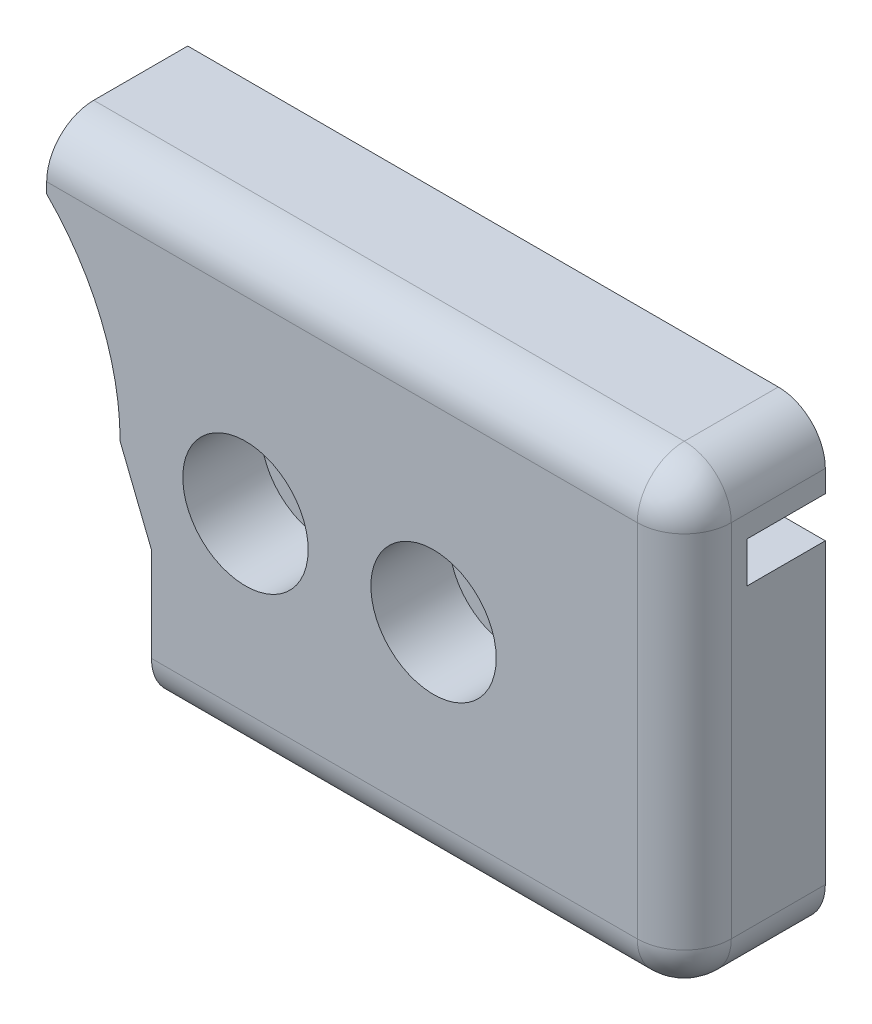
from build123d import *

# Parameters (mm, degrees)
BOSS_EXTRUDE1_DEPTH = 2
BOSS_EXTRUDE2_START = 2.5
BOSS_EXTRUDE2_DEPTH = 2.5
CUT_EXTRUDE1_DEPTH  = 2.5
BOSS_EXTRUDE3_DEPTH = 2.3
SKETCH9_R           = 2.1
CUT_EXTRUDE2_DEPTH  = 2.5
SKETCH10_R          = 2.5
BOSS_EXTRUDE4_DEPTH = 1.2
SKETCH11_R          = 0.95
CUT_EXTRUDE3_DEPTH  = 9.2
SKETCH12_R          = 2
CUT_EXTRUDE4_DEPTH  = 2.5
SKETCH14_W          = 20.343145751
SKETCH14_H          = 1.841510486
SKETCH14_W_2        = 17
SKETCH14_H_2        = 1.34163614
BOSS_EXTRUDE5_DEPTH = 1.2
FILLET1_R           = 1.5
SKETCH17_R          = 0.95
CUT_EXTRUDE5_DEPTH  = 3


# Read off the part's stored shape, not the designer's step: Boss-Extrude3
with BuildPart() as part:
    # Sketch5 → Boss-Extrude1 (new body)
    with BuildSketch(Plane.XY):
        with BuildLine():
            Line((8, 0), (9, -2.501635265))
            Line((9, -2.501635265), (9, -7.001635265))
            Line((9, -7.001635265), (26, -7.001635265))
            Line((26, -7.001635265), (26, 7.498364735))
            Line((26, 7.498364735), (5.656854249, 7.498364735))
            Line((5.656854249, 7.498364735), (5.656854249, 5.656854249))
            ThreePointArc((5.656854249, 5.656854249), (7.39103626, 3.061467459), (8, 0))
        make_face()
    extrude(amount=BOSS_EXTRUDE1_DEPTH)

    # Sketch6 → Boss-Extrude2 (add)
    with BuildSketch(Plane(origin=(0, 0, 0), x_dir=(-1, 0, 0), z_dir=(0, 0, -1)).offset(BOSS_EXTRUDE2_START)):
        with BuildLine():
            Line((-5.656854249, 7.498364735), (-5.656854249, 5.656854249))
            ThreePointArc((-5.656854249, 5.656854249), (-7.39103626, 3.061467459), (-8, 0))
            Line((-8, 0), (-9, -2.501635265))
            Line((-9, -2.501635265), (-9, -7.001635265))
            Line((-9, -7.001635265), (-26, -7.001635265))
            Line((-26, -7.001635265), (-26, 7.498364735))
            Line((-26, 7.498364735), (-5.656854249, 7.498364735))
        make_face()
    extrude(amount=-BOSS_EXTRUDE2_DEPTH)

    # Sketch7 → Cut-Extrude1 (cut)
    with BuildSketch(Plane(origin=(0, 0, -2.5), x_dir=(-1, 0, 0), z_dir=(0, 0, -1))):
        Polygon((-26, 5.298364735), (-2.738141148, 5.298364735), (-2.738141148, 3.998364735), (-29.849535112, 3.998364735), (-29.849535112, 5.298364735), align=None)
    extrude(amount=-CUT_EXTRUDE1_DEPTH, mode=Mode.SUBTRACT)

    # Boss-Extrude3 outline → Boss-Extrude3 (add)
    with BuildSketch(Plane(origin=(0, 0, -2.5), x_dir=(-1, 0, 0), z_dir=(0, 0, -1))):
        with BuildLine():
            Line((-9, -7.001635265), (-9, -5.659999125))
            Line((-9, -5.659999125), (0, -5.659998688))
            ThreePointArc((0, -5.659998688), (5.659998688, 0), (0, 5.659998688))
            Line((0, 5.659998688), (-5.656854249, 5.656854249))
            Line((-5.656854249, 5.656854249), (-5.656854249, 7.498364735))
            Line((-5.656854249, 7.498364735), (-26, 7.498364735))
            Line((-26, 7.498364735), (-26, -7.001635265))
            Line((-26, -7.001635265), (-9, -7.001635265))
        make_face()
    extrude(amount=BOSS_EXTRUDE3_DEPTH)

    # Sketch9 → Cut-Extrude2 (cut)
    with BuildSketch(Plane(origin=(0, 0, -4.8), x_dir=(-1, 0, 0), z_dir=(0, 0, -1))):
        Circle(SKETCH9_R)
    extrude(amount=-CUT_EXTRUDE2_DEPTH, mode=Mode.SUBTRACT)

    # Sketch10 → Boss-Extrude4 (add)
    with BuildSketch(Plane(origin=(0, 0, -4.8), x_dir=(-1, 0, 0), z_dir=(0, 0, -1))):
        with Locations((-12, 0)):
            Circle(SKETCH10_R)
        with Locations((-18, 0)):
            Circle(SKETCH10_R)
    extrude(amount=BOSS_EXTRUDE4_DEPTH)

    # Sketch11 → Cut-Extrude3 (cut)
    with BuildSketch(Plane(origin=(0, 0, -6), x_dir=(-1, 0, 0), z_dir=(0, 0, -1))):
        with Locations((-18, 0)):
            Circle(SKETCH11_R)
        with Locations((-12, 0)):
            Circle(SKETCH11_R)
    extrude(amount=-CUT_EXTRUDE3_DEPTH, mode=Mode.SUBTRACT)

    # Sketch12 → Cut-Extrude4 (cut)
    with BuildSketch(Plane.XY.offset(2)):
        with Locations((12, 0)):
            Circle(SKETCH12_R)
        with Locations((18, 0)):
            Circle(SKETCH12_R)
    extrude(amount=-CUT_EXTRUDE4_DEPTH, mode=Mode.SUBTRACT)

    # Sketch14 → Boss-Extrude5 (add)
    with BuildSketch(Plane(origin=(0, 0, -4.8), x_dir=(-1, 0, 0), z_dir=(0, 0, -1))):
        with Locations((-15.828427124, 6.577609492)):
            Rectangle(SKETCH14_W, SKETCH14_H)
        with Locations((-17.5, -6.330817195)):
            Rectangle(SKETCH14_W_2, SKETCH14_H_2)
    extrude(amount=BOSS_EXTRUDE5_DEPTH)

    # Fillet1
    # the kernel refuses this fillet: 1.5 mm, written as the material it takes off along each edge
    with BuildSketch(Plane(origin=(24.5, -5.501635265, 0.5), x_dir=(0, 0, 1), z_dir=(0, -1, 0))) as fillet1_piece_1_section:
        Polygon((0, 0), (FILLET1_R, 0), (FILLET1_R, -FILLET1_R), (0, -FILLET1_R), align=None)
    fillet1_piece_1 = extrude(amount=FILLET1_R, mode=Mode.PRIVATE)
    fillet1_piece_1 = fillet1_piece_1 - Plane(origin=(24.5, -5.501635265, 0.5), x_dir=(-0.7071067811865475, 0, -0.7071067811865475), z_dir=(0, -1, 0)) * Sphere(FILLET1_R, mode=Mode.PRIVATE)
    add(fillet1_piece_1, mode=Mode.SUBTRACT)
    with BuildSketch(Plane(origin=(24.5, 5.998364735, 0.5), x_dir=(0, 0, 1), z_dir=(0, 1, 0))) as fillet1_piece_2_section:
        Polygon((0, 0), (FILLET1_R, 0), (FILLET1_R, FILLET1_R), (0, FILLET1_R), align=None)
    fillet1_piece_2 = extrude(amount=FILLET1_R, mode=Mode.PRIVATE)
    fillet1_piece_2 = fillet1_piece_2 - Plane(origin=(24.5, 5.998364735, 0.5), x_dir=(-0.7071067811865475, 0, -0.7071067811865475), z_dir=(0, 1, 0)) * Sphere(FILLET1_R, mode=Mode.PRIVATE)
    add(fillet1_piece_2, mode=Mode.SUBTRACT)
    with BuildSketch(Plane(origin=(26, -5.501635265, 2), x_dir=(-1, 0, 0), z_dir=(0, 1, 0))) as fillet1_piece_3:
        with BuildLine():
            CenterArc((FILLET1_R, -FILLET1_R), FILLET1_R, 90, 90)
            Line((0, -FILLET1_R), (0, 0))
            Line((0, 0), (FILLET1_R, 0))
        make_face()
    extrude(amount=11.5, mode=Mode.SUBTRACT)
    with BuildSketch(Plane(origin=(26, -7.001635265, -2.5), x_dir=(-1, 0, 0), z_dir=(0, 0, 1))) as fillet1_piece_4:
        with BuildLine():
            CenterArc((FILLET1_R, -FILLET1_R), FILLET1_R, 90, 90)
            Line((0, -FILLET1_R), (0, 0))
            Line((0, 0), (FILLET1_R, 0))
        make_face()
    extrude(amount=3, mode=Mode.SUBTRACT)
    with BuildSketch(Plane(origin=(5.25, -7.001635265, 2), x_dir=(0, 1, 0), z_dir=(1, 0, 0))) as fillet1_piece_5:
        with BuildLine():
            CenterArc((FILLET1_R, -FILLET1_R), FILLET1_R, 90, 90)
            Line((0, -FILLET1_R), (0, 0))
            Line((0, 0), (FILLET1_R, 0))
        make_face()
    extrude(amount=19.25, mode=Mode.SUBTRACT)
    with BuildSketch(Plane(origin=(24.5, 7.498364735, 2), x_dir=(0, -1, 0), z_dir=(-1, 0, 0))) as fillet1_piece_6:
        with BuildLine():
            CenterArc((FILLET1_R, -FILLET1_R), FILLET1_R, 90, 90)
            Line((0, -FILLET1_R), (0, 0))
            Line((0, 0), (FILLET1_R, 0))
        make_face()
    extrude(amount=22.593145751, mode=Mode.SUBTRACT)
    with BuildSketch(Plane(origin=(26, 7.498364735, -2.5), x_dir=(-1, 0, 0), z_dir=(0, 0, 1))) as fillet1_piece_7:
        with BuildLine():
            CenterArc((FILLET1_R, FILLET1_R), FILLET1_R, 180, 90)
            Line((0, FILLET1_R), (0, 0))
            Line((0, 0), (FILLET1_R, 0))
        make_face()
    extrude(amount=3, mode=Mode.SUBTRACT)
    with BuildSketch(Plane(origin=(26, 7.498364735, -2.5), x_dir=(-1.0, -1.9174232572065026e-10, 0), z_dir=(0, 0, -1))) as fillet1_piece_8:
        with BuildLine():
            CenterArc((FILLET1_R, -FILLET1_R), FILLET1_R, 90.000000011, 90)
            Line((FILLET1_R * 1.9173522033e-10, -FILLET1_R), (0, 0))
            Line((0, 0), (FILLET1_R, 0))
        make_face()
    extrude(amount=2.3, mode=Mode.SUBTRACT)
    with BuildSketch(Plane(origin=(26, 7.498364735, -4.8), x_dir=(-1, 0, 0), z_dir=(0, 0, -1))) as fillet1_piece_9:
        with BuildLine():
            CenterArc((FILLET1_R, -FILLET1_R), FILLET1_R, 90, 90)
            Line((0, -FILLET1_R), (0, 0))
            Line((0, 0), (FILLET1_R, 0))
        make_face()
    extrude(amount=4.95, mode=Mode.SUBTRACT)
    with BuildSketch(Plane(origin=(26, -7.001635265, -2.5), x_dir=(-1.0, -1.9169850891861218e-10, 0), z_dir=(0, 0, -1))) as fillet1_piece_10:
        with BuildLine():
            CenterArc((FILLET1_R, FILLET1_R), FILLET1_R, 180.000000011, 90)
            Line((-FILLET1_R * 1.91707982785e-10, FILLET1_R), (0, 0))
            Line((0, 0), (FILLET1_R, 0))
        make_face()
    extrude(amount=2.3, mode=Mode.SUBTRACT)
    with BuildSketch(Plane(origin=(26, -7.001635265, -4.8), x_dir=(-1, 0, 0), z_dir=(0, 0, -1))) as fillet1_piece_11:
        with BuildLine():
            CenterArc((FILLET1_R, FILLET1_R), FILLET1_R, 180, 90)
            Line((0, FILLET1_R), (0, 0))
            Line((0, 0), (FILLET1_R, 0))
        make_face()
    extrude(amount=4.95, mode=Mode.SUBTRACT)

    # Sketch17 → Cut-Extrude5 (cut)
    with BuildSketch(Plane.XZ.offset(7.001635265)):
        with Locations((22, -1)):
            Circle(SKETCH17_R)
        with Locations((18, -1)):
            Circle(SKETCH17_R)
    extrude(amount=-CUT_EXTRUDE5_DEPTH, mode=Mode.SUBTRACT)


with BuildPart() as body_2:
    # Split1: the piece on the far side of the plane
    add(part.part)
    split(bisect_by=Plane(origin=(0, 0, -2.5), x_dir=(-1, 0, 0), z_dir=(0, 0, -1)), keep=Keep.BOTTOM)


with BuildPart() as part_1:
    add(part.part)

    # Split1
    split(bisect_by=Plane(origin=(0, 0, -2.5), x_dir=(-1, 0, 0), z_dir=(0, 0, -1)), keep=Keep.TOP)


solid = body_2.part
